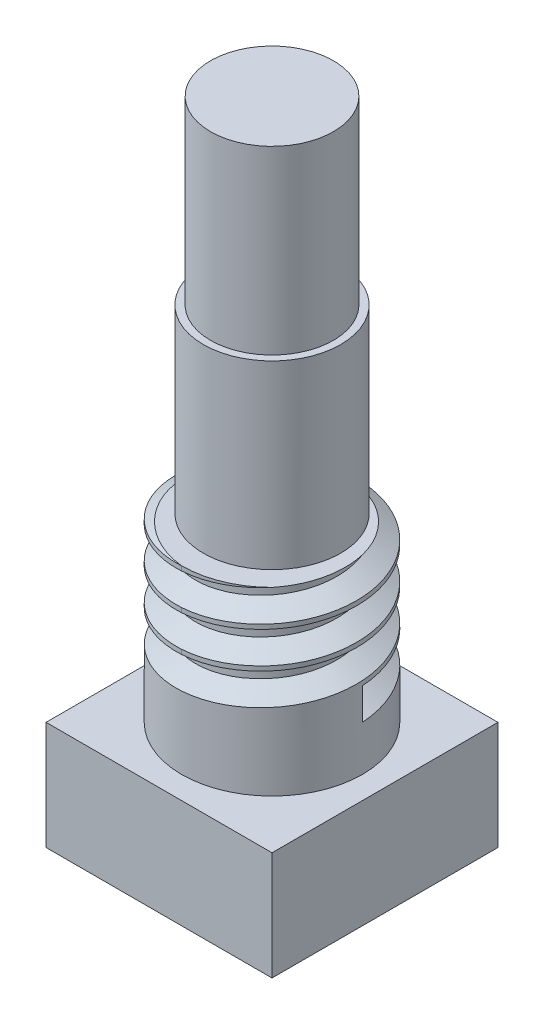
from build123d import *

# Parameters (mm, degrees)
SKETCH1_R           = 2.413
BOSS_EXTRUDE1_DEPTH = 6.35
BOSS_EXTRUDE2_START = 4.762246
SKETCH2_R           = 2.413
BOSS_EXTRUDE2_DEPTH = 4.762246
SKETCH3_R           = 3.175
BOSS_EXTRUDE3_DEPTH = 3.175
SKETCH4_R           = 3.175
BOSS_EXTRUDE4_DEPTH = 3.175
THREAD2_PITCH       = 1.27
SKETCH11_R          = 6.35
BOSS_EXTRUDE5_DEPTH = 3.81
CUT_EXTRUDE1_START  = -0.952246
SKETCH13_R          = 2.413
CUT_EXTRUDE1_DEPTH  = 0.952246
SKETCH14_R          = 2.413
BOSS_EXTRUDE6_DEPTH = 2.54
SKETCH16_W          = 13.786641265
SKETCH16_H          = 13.864798174
SKETCH16_W_2        = 7.9375
SKETCH16_H_2        = 7.9375
CUT_EXTRUDE3_DEPTH  = 3.81
CUT_EXTRUDE4_START  = -6.35
SKETCH17_R          = 2.413
SKETCH17_R_2        = 2.159
CUT_EXTRUDE4_DEPTH  = 6.35


with BuildPart() as part:
    # Sketch1 → Boss-Extrude1 (new body)
    with BuildSketch(Plane(origin=(0, 0, 0), x_dir=(1, 0, 0), z_dir=(0, 1, 0))):
        with Locations(Location((0, 0, 0), (0, 0, 270))):
            Circle(SKETCH1_R)
    extrude(amount=BOSS_EXTRUDE1_DEPTH)

    # Sketch2 → Boss-Extrude2 (add)
    with BuildSketch(Plane(origin=(0, 0, 0), x_dir=(-1, 0, 0), z_dir=(0, -1, 0)).offset(BOSS_EXTRUDE2_START)):
        with Locations(Location((0, 0, 0), (0, 0, 90))):
            Circle(SKETCH2_R)
    extrude(amount=-BOSS_EXTRUDE2_DEPTH)

    # Sketch3 → Boss-Extrude3 (add)
    with BuildSketch(Plane(origin=(0, -4.762246, 0), x_dir=(-1, 0, 0), z_dir=(0, -1, 0))):
        with Locations(Location((0, 0, 0), (0, 0, 90))):
            Circle(SKETCH3_R)
    extrude(amount=BOSS_EXTRUDE3_DEPTH)

    # Sketch4 → Boss-Extrude4 (add)
    with BuildSketch(Plane(origin=(0, -7.937246, 0), x_dir=(-1, 0, 0), z_dir=(0, -1, 0))):
        with Locations(Location((0, 0, 0), (0, 0, 90))):
            Circle(SKETCH4_R)
    extrude(amount=BOSS_EXTRUDE4_DEPTH)

    # Thread2: the profile of Thread Profile3 profile screwed along a right-hand helix of 3.75 turns, 8 arcs to a turn; built about Z, then put on its axis
    thread2_z = Axis((0, 0, 0), (0, 0, 1))
    thread2_corners = [(3.1753, 0, -0.000173205), (3.1753, 0, 1.111423202), (2.487592339, 0, 0.714374998), (2.487592339, 0, 0.396874998)]
    with BuildLine(mode=Mode.PRIVATE) as thread2_profile:
        Line(thread2_corners[0], thread2_corners[1])
        Line(thread2_corners[1], thread2_corners[2])
        Line(thread2_corners[2], thread2_corners[3])
        Line(thread2_corners[3], thread2_corners[0])
    thread2_cap = Face(thread2_profile.wire())
    thread2_turn_angles = [0, 22.5, 45, 67.5, 90, 112.5, 135, 157.5, 180, 202.5, 225, 247.5, 270, 292.5, 315, 337.5, 360]
    thread2_turn_weights = [1, 0.9238795325112867, 1, 0.9238795325112867, 1, 0.9238795325112867, 1, 0.9238795325112867, 1, 0.9238795325112867, 1, 0.9238795325112867, 1, 0.9238795325112867, 1, 0.9238795325112867, 1]
    thread2_turn_rails = [Edge.make_bspline([Vector(p[0], p[1], 0).rotate(thread2_z, thread2_turn_angles[k]) / thread2_turn_weights[k] + Vector(0, 0, p[2] + THREAD2_PITCH * thread2_turn_angles[k] / 360) for k in range(17)], [0, 0, 0, 1, 1, 2, 2, 3, 3, 4, 4, 5, 5, 6, 6, 7, 7, 8, 8, 8], 2, thread2_turn_weights) for p in thread2_corners]
    thread2_turn_sides = [Face.make_surface_from_curves(thread2_turn_rails[p[0]], thread2_turn_rails[p[1]]) for p in [(0, 1), (1, 2), (2, 3), (3, 0)]]
    thread2_last_angles = [1080, 1102.5, 1125, 1147.5, 1170, 1192.5, 1215, 1237.5, 1260, 1282.5, 1305, 1327.5, 1350]
    thread2_last_weights = [1, 0.9238795325112867, 1, 0.9238795325112867, 1, 0.9238795325112867, 1, 0.9238795325112867, 1, 0.9238795325112867, 1, 0.9238795325112883, 1]
    thread2_last_rails = [Edge.make_bspline([Vector(p[0], p[1], 0).rotate(thread2_z, thread2_last_angles[k]) / thread2_last_weights[k] + Vector(0, 0, p[2] + THREAD2_PITCH * thread2_last_angles[k] / 360) for k in range(13)], [0, 0, 0, 1, 1, 2, 2, 3, 3, 4, 4, 5, 5, 6, 6, 6], 2, thread2_last_weights) for p in thread2_corners]
    thread2_last_sides = [Face.make_surface_from_curves(thread2_last_rails[p[0]], thread2_last_rails[p[1]]) for p in [(0, 1), (1, 2), (2, 3), (3, 0)]]
    thread2 = Plane(origin=(0, -9.524746, 0), x_dir=(1, 0, 0), z_dir=(0, 1, 0)) * Solid(Shell([*[p.moved(Location((0, 0, THREAD2_PITCH * i))) for i in range(3) for p in thread2_turn_sides], *thread2_last_sides, thread2_cap, thread2_cap.rotate(thread2_z, 1350).moved(Location((0, 0, THREAD2_PITCH * 1350 / 360)))]))
    add(thread2, mode=Mode.SUBTRACT)

    # Sketch11 → Boss-Extrude5 (add)
    with BuildSketch(Plane(origin=(0, -11.112246, 0), x_dir=(-1, 0, 0), z_dir=(0, -1, 0))):
        with Locations(Location((0, 0, 0), (0, 0, 270))):
            Circle(SKETCH11_R)
    extrude(amount=BOSS_EXTRUDE5_DEPTH)

    # Sketch13 → Cut-Extrude1 (cut)
    with BuildSketch(Plane(origin=(0, 6.35, 0), x_dir=(1, 0, 0), z_dir=(0, 1, 0)).offset(CUT_EXTRUDE1_START)):
        with Locations(Location((0, 0, 0), (0, 0, 90))):
            Circle(SKETCH13_R)
    extrude(amount=CUT_EXTRUDE1_DEPTH, mode=Mode.SUBTRACT)

    # Sketch14 → Boss-Extrude6 (add)
    with BuildSketch(Plane(origin=(0, 5.397754, 0), x_dir=(1, 0, 0), z_dir=(0, 1, 0))):
        with Locations(Location((0, 0, 0), (0, 0, 90))):
            Circle(SKETCH14_R)
    extrude(amount=BOSS_EXTRUDE6_DEPTH)

    # Sketch16 → Cut-Extrude3 (cut)
    with BuildSketch(Plane.XZ.offset(14.922246)):
        with Locations((-0.248819293, 0.124312734)):
            Rectangle(SKETCH16_W, SKETCH16_H)
        Rectangle(SKETCH16_W_2, SKETCH16_H_2, mode=Mode.SUBTRACT)
    extrude(amount=-CUT_EXTRUDE3_DEPTH, mode=Mode.SUBTRACT)

    # Sketch17 → Cut-Extrude4 (cut)
    with BuildSketch(Plane(origin=(0, 7.937754, 0), x_dir=(1, 0, 0), z_dir=(0, 1, 0)).offset(CUT_EXTRUDE4_START)):
        with Locations(Location((0, 0, 0), (0, 0, 90))):
            Circle(SKETCH17_R)
        with Locations(Location((0, 0, 0), (0, 0, 270))):
            Circle(SKETCH17_R_2, mode=Mode.SUBTRACT)
    extrude(amount=CUT_EXTRUDE4_DEPTH, mode=Mode.SUBTRACT)


solid = part.part
